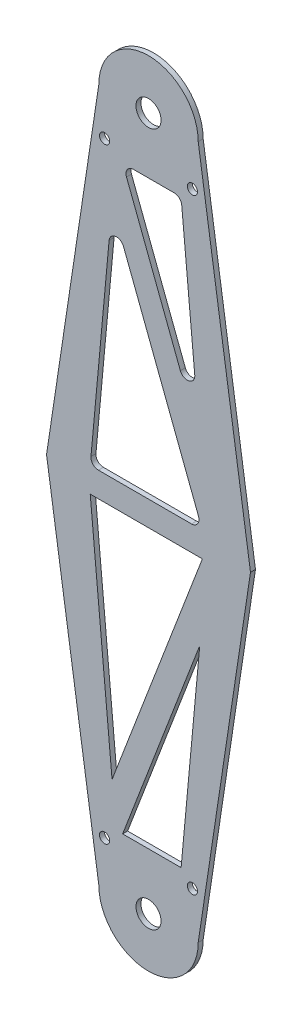
from build123d import *

# Parameters (mm, degrees)
SKETCH_1_R      = 5.05
SKETCH_1_R_2    = 2.05
EXTRUDE_1_DEPTH = 2
FILLET_1_R      = 3


with BuildPart() as part:
    # 草图1 → 凸台-拉伸1 (new body)
    with BuildSketch(Plane.XY):
        with BuildLine():
            Line((-19.791188564, 153.13029316), (-40.841188564, 13.53029316))
            Line((-40.841188564, 13.53029316), (-19.791188564, -126.06970684))
            ThreePointArc((-19.791188564, -126.06970684), (0.208811436, -146.06970684), (20.208811436, -126.06970684))
            Line((20.208811436, -126.06970684), (41.258811436, 13.53029316))
            Line((41.258811436, 13.53029316), (20.208811436, 153.13029316))
            ThreePointArc((20.208811436, 153.13029316), (0.208811436, 173.13029316), (-19.791188564, 153.13029316))
        make_face()
        with Locations((0.208811436, 153.13029316)):
            Circle(SKETCH_1_R, mode=Mode.SUBTRACT)
        with Locations((17.886480965, 135.45262363)):
            Circle(SKETCH_1_R_2, mode=Mode.SUBTRACT)
        with Locations((-17.468858094, 135.45262363)):
            Circle(SKETCH_1_R_2, mode=Mode.SUBTRACT)
        with Locations((-17.468858094, -108.392037311)):
            Circle(SKETCH_1_R_2, mode=Mode.SUBTRACT)
        with Locations((17.886480965, -108.392037311)):
            Circle(SKETCH_1_R_2, mode=Mode.SUBTRACT)
        with Locations((0.208811436, -126.06970684)):
            Circle(SKETCH_1_R, mode=Mode.SUBTRACT)
        Polygon((-10.203497703, -103.392037311), (13.327431673, -103.392037311), (20.829789712, -22.245997591), align=None, mode=Mode.SUBTRACT)
        Polygon((-23.257589156, 18.53029316), (-14.467305111, 113.606632442), (21.893451044, 18.53029316), align=None, mode=Mode.SUBTRACT)
        Polygon((-10.203497703, 130.45262363), (20.829789712, 49.30658391), (13.327431673, 130.45262363), align=None, mode=Mode.SUBTRACT)
        Polygon((21.893451044, 8.53029316), (-23.257589156, 8.53029316), (-14.467305111, -86.546046123), align=None, mode=Mode.SUBTRACT)
    extrude(amount=EXTRUDE_1_DEPTH)

    # 圆角1
    fillet_1_edges = [part.edges().sort_by_distance(p)[0] for p in [
        (20.829789712, 49.30658391, 1),
        (21.893451044, 18.53029316, 1),
        (-23.257589156, 18.53029316, 1),
        (-14.467305111, 113.606632442, 1),
        (13.327431673, 130.45262363, 1),
        (-10.203497703, 130.45262363, 1),
    ]]
    fillet(fillet_1_edges, radius=FILLET_1_R)


solid = part.part
